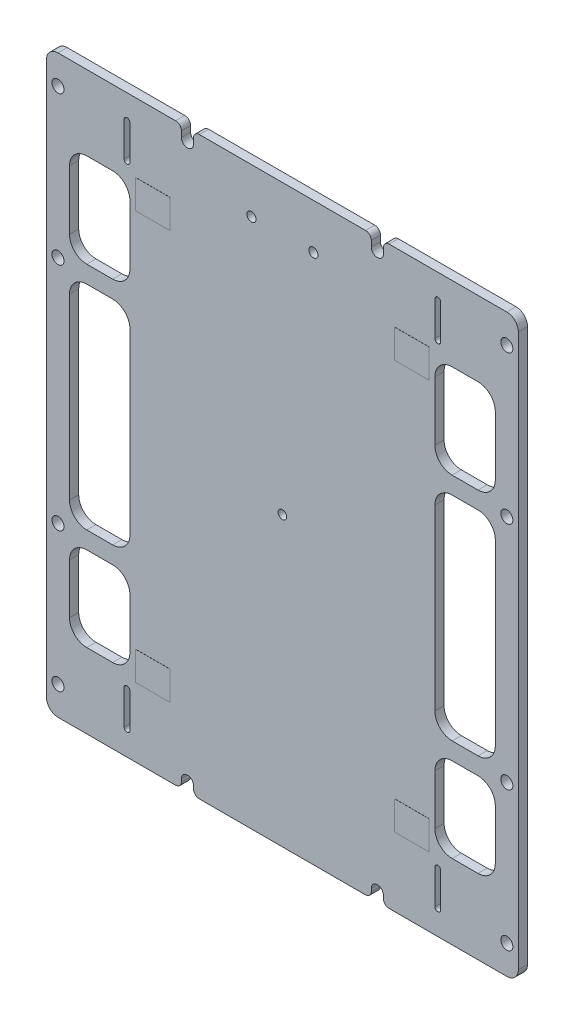
from build123d import *

# Parameters (mm, degrees)
BOARDOUTLINE_DEPTH          = 1.6
SKETCH2_R                   = 0.75
SKETCH2_R_2                 = 0.8
COMPONENTHOLES_DEPTH        = 65.680445267
SOLARCELLCONTACTHOLES_DEPTH = 1.6
WINDOWS_1SIDE_DEPTH         = 65.680445267
SKETCH5_W                   = 6
SKETCH5_H                   = 5
CONTACTPADS_DEPTH           = 0.02
M2_CLEARANCE_HOLE1_D        = 2.1
CUT_EXTRUDE1_DEPTH          = 65.680943098
FILLET3_R                   = 1
FILLET3_OF_MIRROR1_R        = 1


with BuildPart() as part:
    # Sketch1 → boardOutline (new body)
    with BuildSketch(Plane.XY):
        with BuildLine():
            Line((-39, -50), (39, -50))
            ThreePointArc((39, -50), (40.414213562, -49.414213562), (41, -48))
            Line((41, -48), (41, 48))
            ThreePointArc((41, 48), (40.414213562, 49.414213562), (39, 50))
            Line((39, 50), (-39, 50))
            ThreePointArc((-39, 50), (-40.414213562, 49.414213562), (-41, 48))
            Line((-41, 48), (-41, -48))
            ThreePointArc((-41, -48), (-40.414213562, -49.414213562), (-39, -50))
        make_face()
    extrude(amount=BOARDOUTLINE_DEPTH)

    # Sketch2 → componentHoles (cut, through all)
    with BuildSketch(Plane.XY.offset(1.6)):
        Circle(SKETCH2_R)
        with Locations((-5.38, 42.15)):
            Circle(SKETCH2_R_2)
        with Locations((5.39, 42.15)):
            Circle(SKETCH2_R_2)
    extrude(amount=-COMPONENTHOLES_DEPTH, mode=Mode.SUBTRACT)

    # Sketch4 → solarCellContactHoles (cut)
    with BuildSketch(Plane.XY.offset(1.6)):
        with BuildLine():
            Line((-27.5, 39.75), (-27.5, 45.75))
            ThreePointArc((-27.5, 45.75), (-27, 46.25), (-26.5, 45.75))
            Line((-26.5, 45.75), (-26.5, 39.75))
            ThreePointArc((-26.5, 39.75), (-27, 39.25), (-27.5, 39.75))
        make_face()
        with BuildLine():
            Line((26.5, 39.75), (26.5, 45.75))
            ThreePointArc((26.5, 45.75), (27, 46.25), (27.5, 45.75))
            Line((27.5, 45.75), (27.5, 39.75))
            ThreePointArc((27.5, 39.75), (27, 39.25), (26.5, 39.75))
        make_face()
        with BuildLine():
            Line((26.5, -45.75), (26.5, -39.75))
            ThreePointArc((26.5, -39.75), (27, -39.25), (27.5, -39.75))
            Line((27.5, -39.75), (27.5, -45.75))
            ThreePointArc((27.5, -45.75), (27, -46.25), (26.5, -45.75))
        make_face()
        with BuildLine():
            Line((-27.5, -45.75), (-27.5, -39.75))
            ThreePointArc((-27.5, -39.75), (-27, -39.25), (-26.5, -39.75))
            Line((-26.5, -39.75), (-26.5, -45.75))
            ThreePointArc((-26.5, -45.75), (-27, -46.25), (-27.5, -45.75))
        make_face()
    extrude(amount=-SOLARCELLCONTACTHOLES_DEPTH, mode=Mode.SUBTRACT)

    # Sketch3 → windows_1side (cut, through all)
    with BuildSketch(Plane.XY.offset(1.6)):
        with BuildLine():
            Line((-34, 37), (-29.5, 37))
            ThreePointArc((-29.5, 37), (-27.378679656, 36.121320344), (-26.5, 34))
            Line((-26.5, 34), (-26.5, 23.7))
            ThreePointArc((-26.5, 23.7), (-27.378679656, 21.578679656), (-29.5, 20.7))
            Line((-29.5, 20.7), (-34, 20.7))
            ThreePointArc((-34, 20.7), (-36.121320344, 21.578679656), (-37, 23.7))
            Line((-37, 23.7), (-37, 34))
            ThreePointArc((-37, 34), (-36.121320344, 36.121320344), (-34, 37))
        make_face()
        with BuildLine():
            Line((-29.5, -22.3), (-34, -22.3))
            ThreePointArc((-34, -22.3), (-36.121320344, -23.178679656), (-37, -25.3))
            Line((-37, -25.3), (-37, -34))
            ThreePointArc((-37, -34), (-36.121320344, -36.121320344), (-34, -37))
            Line((-34, -37), (-29.5, -37))
            ThreePointArc((-29.5, -37), (-27.378679656, -36.121320344), (-26.5, -34))
            Line((-26.5, -34), (-26.5, -25.3))
            ThreePointArc((-26.5, -25.3), (-27.378679656, -23.178679656), (-29.5, -22.3))
        make_face()
        with BuildLine():
            Line((-29.5, -19.3), (-34, -19.3))
            ThreePointArc((-34, -19.3), (-36.121320344, -18.421320344), (-37, -16.3))
            Line((-37, -16.3), (-37, 14.7))
            ThreePointArc((-37, 14.7), (-36.121320344, 16.821320344), (-34, 17.7))
            Line((-34, 17.7), (-29.5, 17.7))
            ThreePointArc((-29.5, 17.7), (-27.378679656, 16.821320344), (-26.5, 14.7))
            Line((-26.5, 14.7), (-26.5, -16.3))
            ThreePointArc((-26.5, -16.3), (-27.378679656, -18.421320344), (-29.5, -19.3))
        make_face()
    windows_1side = extrude(amount=-WINDOWS_1SIDE_DEPTH, mode=Mode.SUBTRACT)

    # Sketch5 → contactPads (add)
    with BuildSketch(Plane.XY.offset(1.6)):
        with Locations((-22.5, 35.5)):
            Rectangle(SKETCH5_W, SKETCH5_H)
        with Locations((22.5, 35.5)):
            Rectangle(SKETCH5_W, SKETCH5_H)
        with Locations((22.5, -35.5)):
            Rectangle(SKETCH5_W, SKETCH5_H)
        with Locations((-22.5, -35.5)):
            Rectangle(SKETCH5_W, SKETCH5_H)
    extrude(amount=CONTACTPADS_DEPTH)

    # M2 Clearance Hole1 (through all)
    with Locations(Plane(origin=(0, 0, 0), x_dir=(-1, 0, 0), z_dir=(0, 0, -1))):
        with Locations((39, 45), (39, -20.8), (39, -45), (39, 19.2)):
            m2_clearance_hole1 = Hole(M2_CLEARANCE_HOLE1_D / 2)

    # Sketch10 → Cut-Extrude1 (cut, symmetric)
    with BuildSketch(Plane(origin=(0, 0, 0), x_dir=(-1, 0, 0), z_dir=(0, 0, -1))):
        with BuildLine():
            Line((15.45, 48), (15.45, 55.073166109))
            ThreePointArc((15.45, 55.073166109), (16.5, 56.123166109), (17.55, 55.073166109))
            Line((17.55, 55.073166109), (17.55, 48))
            ThreePointArc((17.55, 48), (16.5, 46.95), (15.45, 48))
        make_face()
        with BuildLine():
            Line((17.55, -48.5), (17.55, -55.573166109))
            ThreePointArc((17.55, -55.573166109), (16.5, -56.623166109), (15.45, -55.573166109))
            Line((15.45, -55.573166109), (15.45, -48.5))
            ThreePointArc((15.45, -48.5), (16.5, -47.45), (17.55, -48.5))
        make_face()
    cut_extrude1 = extrude(amount=CUT_EXTRUDE1_DEPTH, both=True, mode=Mode.SUBTRACT)

    # Fillet3
    fillet3_edges = [part.edges().sort_by_distance(p)[0] for p in [
        (-17.55, 50, 0.8),
        (-15.45, 50, 0.8),
        (-15.45, -50, 0.8),
        (-17.55, -50, 0.8),
    ]]
    fillet(fillet3_edges, radius=FILLET3_R)

    # Mirror1: windows_1side, M2 Clearance Hole1, Cut-Extrude1 across plane
    add(windows_1side.mirror(Plane(origin=(0, 0, 0), x_dir=(0, 0, 1), z_dir=(1, 0, 0))), mode=Mode.SUBTRACT)
    add(m2_clearance_hole1.mirror(Plane(origin=(0, 0, 0), x_dir=(0, 0, 1), z_dir=(1, 0, 0))), mode=Mode.SUBTRACT)
    add(cut_extrude1.mirror(Plane(origin=(0, 0, 0), x_dir=(0, 0, 1), z_dir=(1, 0, 0))), mode=Mode.SUBTRACT)

    # Fillet3 of Mirror1
    fillet3_of_mirror1_edges = [part.edges().sort_by_distance(p)[0] for p in [
        (17.55, 50, 0.8),
        (15.45, 50, 0.8),
        (15.45, -50, 0.8),
        (17.55, -50, 0.8),
    ]]
    fillet(fillet3_of_mirror1_edges, radius=FILLET3_OF_MIRROR1_R)


solid = part.part
